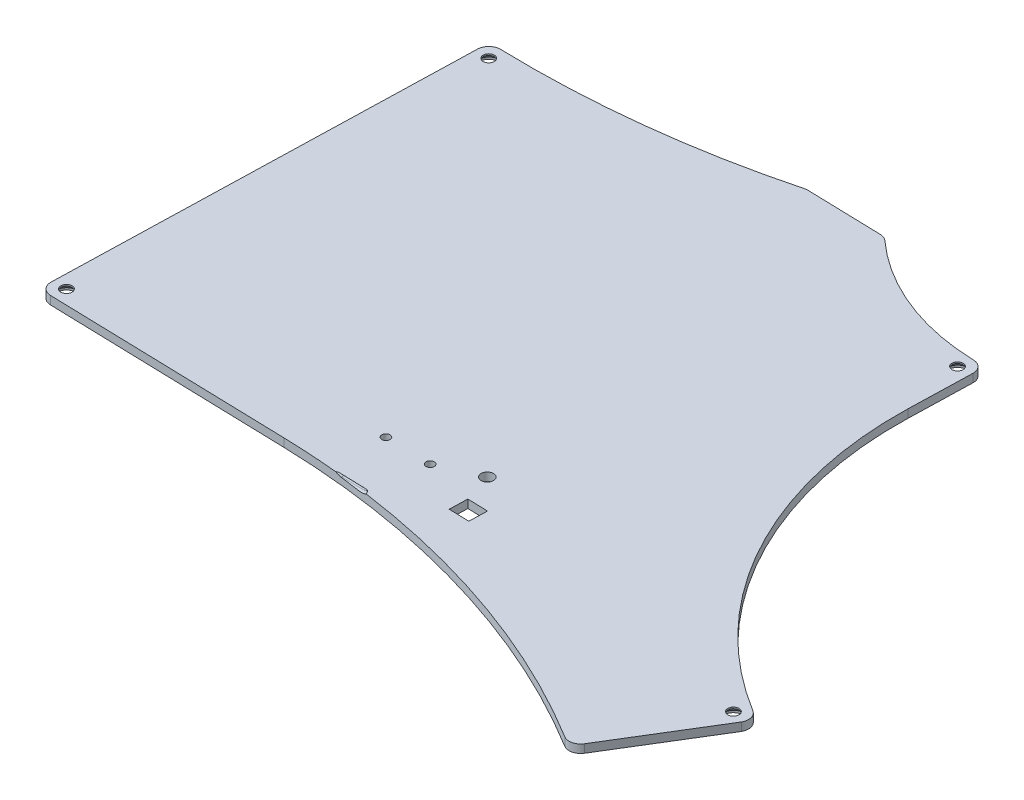
from build123d import *

# Parameters (mm, degrees)
SKETCH7_R                = 1
SKETCH7_R_2              = 1.5
SKETCH7_R_3              = 1.35
MAIN_PLATE_DEPTH         = 2
CHARGE_PORT_FLLET_R      = 0.3
SKETCH10_R               = 2.5
SCREW_HOLES_DEPTH        = 1.7
SCREW_HOLES_CHAMFER_SIZE = 1.2


with BuildPart() as part:
    # Sketch7 → Main_plate (new body)
    with BuildSketch(Plane(origin=(0, 0, 0), x_dir=(1, 0, 0), z_dir=(0, 1, 0))):
        with BuildLine():
            Line((-104.023215078, 7.316749514), (-106.797390349, -93.144954391))
            ThreePointArc((-106.797390349, -93.144954391), (-106.032254445, -95.146736777), (-104.07574776, -96.021177891))
            Line((-104.07574776, -96.021177891), (-45.885269032, -97.628064702))
            ThreePointArc((-45.885269032, -97.628064702), (4.285255603, -105.624406052), (50.695402381, -126.291319055))
            ThreePointArc((50.695402381, -126.291319055), (52.812174305, -126.625747368), (54.545434613, -125.365440114))
            Line((54.545434613, -125.365440114), (68.990750601, -101.772440989))
            ThreePointArc((68.990750601, -101.772440989), (69.223862062, -99.714931621), (67.981742697, -98.05818021))
            ThreePointArc((67.981742697, -98.05818021), (34.717808657, -63.000530051), (23.481809811, -15.997546396))
            Line((23.481809811, -15.997546396), (23.903754887, -0.717574065))
            ThreePointArc((23.903754887, -0.717574065), (23.138618984, 1.284208321), (21.182112299, 2.158649434))
            ThreePointArc((21.182112299, 2.158649434), (2.003898261, 6.128244847), (-14.619536468, 16.483098745))
            ThreePointArc((-14.619536468, 16.483098745), (-15.454114646, 17.002963336), (-16.41695531, 17.202256548))
            Line((-16.41695531, 17.202256548), (-34.410096308, 17.699123761))
            ThreePointArc((-34.410096308, 17.699123761), (-34.806702023, 17.681923588), (-35.196889178, 17.608807767))
            ThreePointArc((-35.196889178, 17.608807767), (-67.90293394, 11.4801352), (-101.146991579, 10.038392103))
            ThreePointArc((-101.146991579, 10.038392103), (-103.148773965, 9.273256199), (-104.023215078, 7.316749514))
        make_face()
        with Locations(Location((-33.748541786, -85.138324407, 0), (0, 0, 270))):
            Circle(SKETCH7_R, mode=Mode.SUBTRACT)
        with Locations(Location((-22.752733399, -85.441965481, 0), (0, 0, 270))):
            Circle(SKETCH7_R, mode=Mode.SUBTRACT)
        with Locations(Location((-13.132688699, -81.225908084, 0), (0, 0, 270))):
            Circle(SKETCH7_R_2, mode=Mode.SUBTRACT)
        with Locations(Location((-103.484845965, -92.736237241, 0), (0, 0, 270))):
            Circle(SKETCH7_R_3, mode=Mode.SUBTRACT)
        with Locations(Location((-100.738259931, 6.72637273, 0), (0, 0, 270))):
            Circle(SKETCH7_R_3, mode=Mode.SUBTRACT)
        with Locations(Location((20.591268917, -1.124175901, 0), (0, 0, 270))):
            Circle(SKETCH7_R_3, mode=Mode.SUBTRACT)
        with Locations(Location((65.832836662, -100.610366639, 0), (0, 0, 270))):
            Circle(SKETCH7_R_3, mode=Mode.SUBTRACT)
        Polygon((-10.87408805, -88.190907948), (-5.975955223, -88.326166245), (-6.097411653, -92.7244896), (-10.99554448, -92.589231303), align=None, mode=Mode.SUBTRACT)
    extrude(amount=-MAIN_PLATE_DEPTH)

    # Sketch8 → Charge_port section 0
    with BuildSketch(Plane(origin=(-2.734355993, 0, 99.019721328), x_dir=(0.9996189443320018, 0, 0.027603734033176643), z_dir=(-0.027603734033176643, 0, 0.9996189443320018))):
        with BuildLine():
            Line((-28.28554605, 7.25), (-23.48554605, 7.25))
            ThreePointArc((-23.48554605, 7.25), (-19.73554605, 3.5), (-23.48554605, -0.25))
            Line((-23.48554605, -0.25), (-28.28554605, -0.25))
            ThreePointArc((-28.28554605, -0.25), (-32.03554605, 3.5), (-28.28554605, 7.25))
        make_face()
    # Sketch9 → Charge_port section 1
    with BuildSketch(Plane(origin=(-2.872374664, 0, 104.017816049), x_dir=(0.9996189443320018, 0, 0.027603734033176643), z_dir=(-0.027603734033176643, 0, 0.9996189443320018))):
        with BuildLine():
            Line((-28.28554605, -1.75), (-23.48554605, -1.75))
            ThreePointArc((-23.48554605, -1.75), (-18.23554605, 3.5), (-23.48554605, 8.75))
            Line((-23.48554605, 8.75), (-28.28554605, 8.75))
            ThreePointArc((-28.28554605, 8.75), (-33.53554605, 3.5), (-28.28554605, -1.75))
        make_face()
    loft(mode=Mode.SUBTRACT)

    # Charge_port_fllet
    charge_port_fllet_edges = [part.edges().sort_by_distance(p)[0] for p in [
        (-31.693515982, -0.186970301, 98.220035653),
        (-25.526560437, -0.186970301, 98.390331546),
        (-28.61003821, -0.25, 98.305183599),
    ]]
    fillet(charge_port_fllet_edges, radius=CHARGE_PORT_FLLET_R)

    # Sketch10 → Screw_holes (cut)
    with BuildSketch(Plane.XZ.offset(2)):
        with Locations(Location((-103.484845965, 92.736237241, 0), (0, 0, 270))):
            Circle(SKETCH10_R)
        with Locations(Location((65.832836662, 100.610366639, 0), (0, 0, 270))):
            Circle(SKETCH10_R)
        with Locations(Location((20.591268917, 1.124175901, 0), (0, 0, 270))):
            Circle(SKETCH10_R)
        with Locations(Location((-100.738259931, -6.72637273, 0), (0, 0, 270))):
            Circle(SKETCH10_R)
    extrude(amount=-SCREW_HOLES_DEPTH, mode=Mode.SUBTRACT)

    # Screw_holes_chamfer
    # the kernel refuses this chamfer: 1.2 mm, written as the material it adds along each edge
    with BuildSketch(Plane(origin=(65.832836662, -0.3, 100.610366639), x_dir=(0, 0, -1), z_dir=(-1, 0, 0))) as screw_holes_chamfer_piece_1_section:
        Polygon((2.5 - SCREW_HOLES_CHAMFER_SIZE, 0), (2.5, SCREW_HOLES_CHAMFER_SIZE), (2.5, 0), align=None)
    screw_holes_chamfer_piece_1 = revolve(axis=Axis((65.832836662, -0.3, 100.610366639), (0, -1, 0)), mode=Mode.PRIVATE)
    screw_holes_chamfer_piece_1 = screw_holes_chamfer_piece_1 - Plane(origin=(65.832836662, -0.926520071, 100.610366639), x_dir=(0, 0, 1), z_dir=(0, 1, 0)) * Cylinder(1.35, 11, mode=Mode.PRIVATE)
    add(screw_holes_chamfer_piece_1)
    with BuildSketch(Plane(origin=(-103.484845965, -0.3, 92.736237241), x_dir=(0, 0, -1), z_dir=(-1, 0, 0))) as screw_holes_chamfer_piece_2_section:
        Polygon((2.5 - SCREW_HOLES_CHAMFER_SIZE, 0), (2.5, SCREW_HOLES_CHAMFER_SIZE), (2.5, 0), align=None)
    screw_holes_chamfer_piece_2 = revolve(axis=Axis((-103.484845965, -0.3, 92.736237241), (0, -1, 0)), mode=Mode.PRIVATE)
    screw_holes_chamfer_piece_2 = screw_holes_chamfer_piece_2 - Plane(origin=(-103.484845965, -0.926520071, 92.736237241), x_dir=(0, 0, 1), z_dir=(0, 1, 0)) * Cylinder(1.35, 11, mode=Mode.PRIVATE)
    add(screw_holes_chamfer_piece_2)
    with BuildSketch(Plane(origin=(-100.738259931, -0.3, -6.72637273), x_dir=(0, 0, -1), z_dir=(-1, 0, 0))) as screw_holes_chamfer_piece_3_section:
        Polygon((2.5 - SCREW_HOLES_CHAMFER_SIZE, 0), (2.5, SCREW_HOLES_CHAMFER_SIZE), (2.5, 0), align=None)
    screw_holes_chamfer_piece_3 = revolve(axis=Axis((-100.738259931, -0.3, -6.72637273), (0, -1, 0)), mode=Mode.PRIVATE)
    screw_holes_chamfer_piece_3 = screw_holes_chamfer_piece_3 - Plane(origin=(-100.738259931, -0.926520071, -6.72637273), x_dir=(0, 0, 1), z_dir=(0, 1, 0)) * Cylinder(1.35, 10, mode=Mode.PRIVATE)
    add(screw_holes_chamfer_piece_3)
    with BuildSketch(Plane(origin=(20.591268917, -0.3, 1.124175901), x_dir=(0, 0, -1), z_dir=(-1, 0, 0))) as screw_holes_chamfer_piece_4_section:
        Polygon((2.5 - SCREW_HOLES_CHAMFER_SIZE, 0), (2.5, SCREW_HOLES_CHAMFER_SIZE), (2.5, 0), align=None)
    screw_holes_chamfer_piece_4 = revolve(axis=Axis((20.591268917, -0.3, 1.124175901), (0, -1, 0)), mode=Mode.PRIVATE)
    screw_holes_chamfer_piece_4 = screw_holes_chamfer_piece_4 - Plane(origin=(20.591268917, -0.926520071, 1.124175901), x_dir=(0, 0, 1), z_dir=(0, 1, 0)) * Cylinder(1.35, 10, mode=Mode.PRIVATE)
    add(screw_holes_chamfer_piece_4)


solid = part.part
